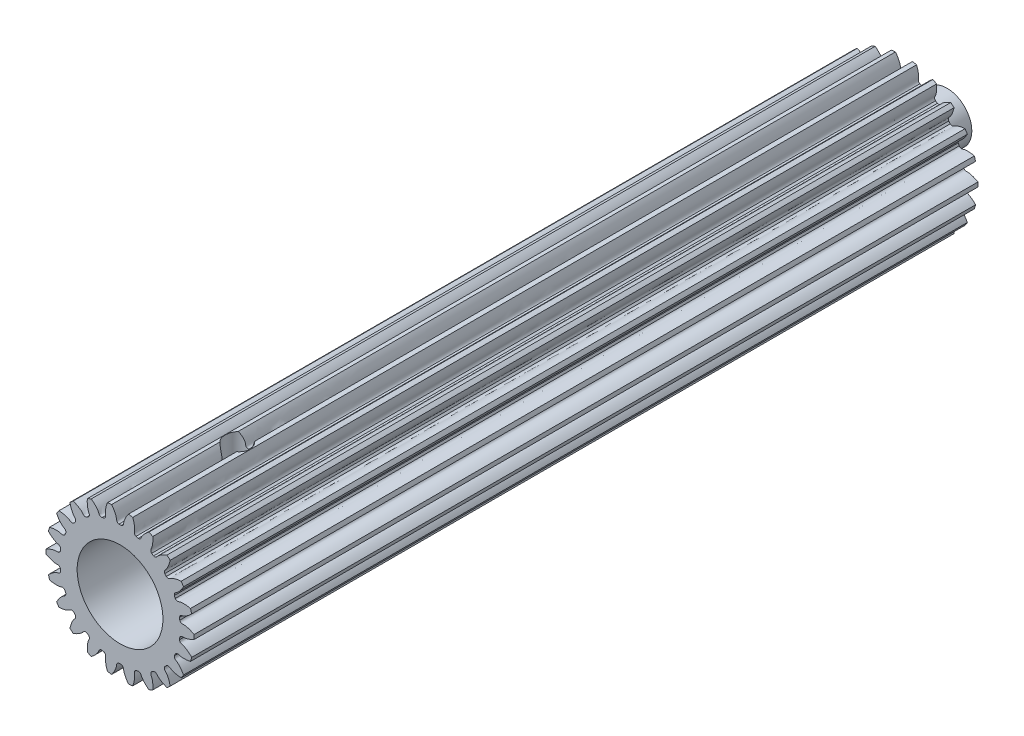
from build123d import *
from build123d.topology import SkipClean

# Parameters (mm, degrees)
SKETCH_1_R               = 12
EXTRUDE_1_DEPTH          = 30
CUT_EXTRUDE_1_DEPTH      = 35.467375879
PATTERN_CIRCULAR_1_COUNT = 22
EXTRUDE_START            = 97
EXTRUDE_2_DEPTH          = 97
SKETCH_12_R              = 5
EXTRUDE_7_DEPTH          = 1
CUT_EXTRUDE_START        = 130
SKETCH_15_R              = 2
CUT_EXTRUDE_3_DEPTH      = 231.171769671
SKETCH_16_R              = 6.95
CUT_EXTRUDE_4_DEPTH      = 25
CUT_EXTRUDE_START_2      = -1
SKETCH_17_R              = 5
CUT_EXTRUDE_5_DEPTH      = 1
SKETCH_18_R              = 4
EXTRUDE_8_DEPTH          = 7


with BuildPart() as part:
    # 草图1 → 凸台-拉伸1 (new body)
    with BuildSketch(Plane.XY):
        Circle(SKETCH_1_R)
    extrude(amount=EXTRUDE_1_DEPTH)

    # 草图2 → 切除-拉伸1 (cut, through all)
    with BuildSketch(Plane.XY):
        with BuildLine():
            ThreePointArc((0.185665431, 9.748232063), (0, 9.75), (-0.185665431, 9.748232063))
            add(Edge.make_bspline(
                [(-0.185665431, 9.748232063), (-0.588158706, 9.876186429), (-0.548347264, 10.151774696), (-0.599584047, 10.42157039), (-0.60596118, 10.451918903), (-0.613876897, 10.486162213), (-0.623483721, 10.524250431), (-0.634939934, 10.566127653), (-0.648399943, 10.611733662), (-0.664017171, 10.661003439), (-0.681942991, 10.713867378), (-0.70232689, 10.77025128), (-0.72531626, 10.830076418), (-0.751056303, 10.893259589), (-0.779689902, 10.959713172), (-0.811357505, 11.029345185), (-0.846197011, 11.10205935), (-0.884343649, 11.177755162), (-0.925929868, 11.25632795), (-0.971085225, 11.337668957), (-1.019936271, 11.421665408), (-1.072606448, 11.508200591), (-1.129215979, 11.597153935), (-1.189881763, 11.688401095), (-1.254717274, 11.781814033), (-1.323832459, 11.877261111), (-1.397333644, 11.974607178), (-1.475323431, 12.073713662), (-1.557900608, 12.174438668), (-1.64516006, 12.276637076), (-1.737192673, 12.380160638), (-1.834085256, 12.484858081), (-1.935920447, 12.590575215), (-2.042776642, 12.697155033), (-2.154727905, 12.804437827), (-2.271843904, 12.912261294), (-2.394189822, 13.020460649), (-2.521826308, 13.128868741), (-2.654809363, 13.237316171), (-2.841488127, 13.383435539), (-2.986445715, 13.489968103), (-3.085558798, 13.559868128)],
                knots=[0, 0, 0, 0, 0.157021319, 0.162530984, 0.168888289, 0.176093235, 0.184145822, 0.19304605, 0.202793918, 0.213389427, 0.224832576, 0.237123367, 0.250261798, 0.264247869, 0.279081582, 0.294762935, 0.311291928, 0.328668563, 0.346892838, 0.365964754, 0.38588431, 0.406651508, 0.428266346, 0.450728824, 0.474038944, 0.498196704, 0.523202104, 0.549055146, 0.575755828, 0.603304151, 0.631700114, 0.660943719, 0.691034964, 0.721973849, 0.753760376, 0.786394543, 0.819876351, 0.854205799, 0.889382888, 0.925407618, 1, 1, 1, 1], degree=3))
            ThreePointArc((-3.085558798, 13.559868128), (0, 13.906498364), (3.085558798, 13.559868128))
            add(Edge.make_bspline(
                [(0.185665431, 9.748232063), (0.588158706, 9.876186429), (0.548347264, 10.151774696), (0.599584047, 10.42157039), (0.60596118, 10.451918903), (0.613876897, 10.486162213), (0.623483721, 10.524250431), (0.634939934, 10.566127653), (0.648399943, 10.611733662), (0.664017171, 10.661003439), (0.681942991, 10.713867378), (0.70232689, 10.77025128), (0.72531626, 10.830076418), (0.751056303, 10.893259589), (0.779689902, 10.959713172), (0.811357505, 11.029345185), (0.846197011, 11.10205935), (0.884343649, 11.177755162), (0.925929868, 11.25632795), (0.971085225, 11.337668957), (1.019936271, 11.421665408), (1.072606448, 11.508200591), (1.129215979, 11.597153935), (1.189881763, 11.688401095), (1.254717274, 11.781814033), (1.323832459, 11.877261111), (1.397333644, 11.974607178), (1.475323431, 12.073713662), (1.557900608, 12.174438668), (1.64516006, 12.276637076), (1.737192673, 12.380160638), (1.834085256, 12.484858081), (1.935920447, 12.590575215), (2.042776642, 12.697155033), (2.154727905, 12.804437827), (2.271843904, 12.912261294), (2.394189822, 13.020460649), (2.521826308, 13.128868741), (2.654809363, 13.237316171), (2.841488127, 13.383435539), (2.986445715, 13.489968103), (3.085558798, 13.559868128)],
                knots=[0, 0, 0, 0, 0.157021319, 0.162530984, 0.168888289, 0.176093235, 0.184145822, 0.19304605, 0.202793918, 0.213389427, 0.224832576, 0.237123367, 0.250261798, 0.264247869, 0.279081582, 0.294762935, 0.311291928, 0.328668563, 0.346892838, 0.365964754, 0.38588431, 0.406651508, 0.428266346, 0.450728824, 0.474038944, 0.498196704, 0.523202104, 0.549055146, 0.575755828, 0.603304151, 0.631700114, 0.660943719, 0.691034964, 0.721973849, 0.753760376, 0.786394543, 0.819876351, 0.854205799, 0.889382888, 0.925407618, 1, 1, 1, 1], degree=3))
        make_face()
    cut_extrude_1 = extrude(amount=CUT_EXTRUDE_1_DEPTH, mode=Mode.SUBTRACT)

    # 阵列(圆周)1: 切除-拉伸1 ×22 about axis
    pattern_circular_1_axis = Axis((0, 0, -1.5), (0, 0, 1))
    for i in range(1, PATTERN_CIRCULAR_1_COUNT):
        add(cut_extrude_1.rotate(pattern_circular_1_axis, i * 360 / PATTERN_CIRCULAR_1_COUNT), mode=Mode.SUBTRACT)

    # 草图4 → 凸台-拉伸2 (add)
    with BuildSketch(Plane(origin=(0, 0, 0), x_dir=(-1, 0, 0), z_dir=(0, 0, -1)).offset(EXTRUDE_START)):
        with BuildLine():
            ThreePointArc((2.924539021, 9.301052173), (2.746892429, 9.355056493), (2.568249667, 9.405668166))
            add(Edge.make_bspline(
                [(2.568249667, 9.405668166), (2.218109108, 9.641834941), (2.333950094, 9.895043767), (2.361944393, 10.180005258), (2.365849304, 10.238460497), (2.368085913, 10.32113962), (2.366834845, 10.420382901), (2.360772595, 10.536017252), (2.34858845, 10.667790208), (2.32898426, 10.815370787), (2.300679804, 10.978350119), (2.26241667, 11.156242389), (2.212962422, 11.348485973), (2.151114634, 11.554444777), (2.096274933, 11.713680077), (2.062581682, 11.80433527), (2.055688884, 11.822611522)],
                knots=[0, 0, 0, 0, 0.157021319, 0.162530984, 0.176093235, 0.19304605, 0.213389427, 0.237123367, 0.264247869, 0.294762935, 0.328668563, 0.365964754, 0.406651508, 0.450728824, 0.498196704, 0.510209942, 0.510209942, 0.510209942, 0.510209942], degree=3))
            ThreePointArc((2.055688884, 11.822611522), (1.707778059, 11.877857303), (1.358395532, 11.922867171))
            add(Edge.make_bspline(
                [(1.358395532, 11.922867171), (1.300155371, 11.845656586), (1.201946581, 11.708817962), (1.073915974, 11.512256119), (0.972303664, 11.341732625), (0.885472389, 11.181826213), (0.812397844, 11.033422979), (0.752009469, 10.897343589), (0.703194045, 10.774341044), (0.670055832, 10.680054419), (0.644027119, 10.597938124), (0.627360159, 10.539619361), (0.611348785, 10.476138997), (0.60176986, 10.433080149), (0.548347264, 10.151774696), (0.588158706, 9.876186429), (0.185665431, 9.748232063)],
                knots=[0.489790058, 0.489790058, 0.489790058, 0.489790058, 0.549271176, 0.593348492, 0.634035246, 0.671331437, 0.705237065, 0.735752131, 0.762876633, 0.786610573, 0.797206082, 0.815854178, 0.823906765, 0.837469016, 0.842978681, 1, 1, 1, 1], degree=3))
            ThreePointArc((0.185665431, 9.748232063), (0, 9.75), (-0.185665431, 9.748232063))
            add(Edge.make_bspline(
                [(-0.185665431, 9.748232063), (-0.588158706, 9.876186429), (-0.548347264, 10.151774696), (-0.60176986, 10.433080149), (-0.61449187, 10.490267681), (-0.635639261, 10.570227844), (-0.664799714, 10.665098608), (-0.703194362, 10.774341023), (-0.752009695, 10.897343577), (-0.812398032, 11.033422968), (-0.885472542, 11.181826205), (-0.972303795, 11.341732617), (-1.073916075, 11.512256114), (-1.191283893, 11.692447604), (-1.288763969, 11.829782626), (-1.346632927, 11.907273161), (-1.358395532, 11.922867171)],
                knots=[0, 0, 0, 0, 0.157021319, 0.162530984, 0.176093235, 0.19304605, 0.213389427, 0.237123367, 0.264247869, 0.294762935, 0.328668563, 0.365964754, 0.406651508, 0.450728824, 0.498196704, 0.510209942, 0.510209942, 0.510209942, 0.510209942], degree=3))
            ThreePointArc((-1.358395532, 11.922867171), (-1.707778059, 11.877857303), (-2.055688884, 11.822611522))
            add(Edge.make_bspline(
                [(-2.055688884, 11.822611522), (-2.089817174, 11.732120359), (-2.145495923, 11.573156047), (-2.21296252, 11.34848595), (-2.262416797, 11.156242359), (-2.300679954, 10.978350084), (-2.328984444, 10.815370745), (-2.348588671, 10.667790156), (-2.360772906, 10.536017183), (-2.366005176, 10.436213716), (-2.36784471, 10.350090571), (-2.367406247, 10.289438503), (-2.364884562, 10.224018615), (-2.361944393, 10.180005258), (-2.333950094, 9.895043767), (-2.218109108, 9.641834941), (-2.568249667, 9.405668166)],
                knots=[0.489790058, 0.489790058, 0.489790058, 0.489790058, 0.549271176, 0.593348492, 0.634035246, 0.671331437, 0.705237065, 0.735752131, 0.762876633, 0.786610573, 0.797206082, 0.815854178, 0.823906765, 0.837469016, 0.842978681, 1, 1, 1, 1], degree=3))
            ThreePointArc((-2.568249667, 9.405668166), (-2.746892429, 9.355056493), (-2.924539021, 9.301052173))
            add(Edge.make_bspline(
                [(-2.924539021, 9.301052173), (-3.3467774, 9.310428028), (-3.386220788, 9.586069213), (-3.516732299, 9.840928935), (-3.545050567, 9.892215766), (-3.587868721, 9.962979072), (-3.642576155, 10.045791454), (-3.710192695, 10.139791761), (-3.791684488, 10.244058979), (-3.887964667, 10.357612838), (-3.999889169, 10.479417233), (-4.128253989, 10.608383121), (-4.273792278, 10.74337173), (-4.437171685, 10.883197863), (-4.569394878, 10.987506541), (-4.646751344, 11.045554595), (-4.662430821, 11.057203029)],
                knots=[0, 0, 0, 0, 0.157021319, 0.162530984, 0.176093235, 0.19304605, 0.213389427, 0.237123367, 0.264247869, 0.294762935, 0.328668563, 0.365964754, 0.406651508, 0.450728824, 0.498196704, 0.510209942, 0.510209942, 0.510209942, 0.510209942], degree=3))
            ThreePointArc((-4.662430821, 11.057203029), (-4.984980156, 10.915583944), (-5.303233613, 10.7645582))
            add(Edge.make_bspline(
                [(-5.303233613, 10.7645582), (-5.310485161, 10.668117515), (-5.319123107, 10.499905858), (-5.320559952, 10.265328941), (-5.313849705, 10.066939687), (-5.300444889, 9.885473322), (-5.281686262, 9.721121495), (-5.258918124, 9.573995807), (-5.233484075, 9.44412787), (-5.210386516, 9.346893044), (-5.187887842, 9.263740235), (-5.170379477, 9.205668531), (-5.149529026, 9.143609049), (-5.134307959, 9.102206883), (-5.027164697, 8.83667524), (-4.844678915, 8.626359328), (-5.114100451, 8.301112972)],
                knots=[0.489790058, 0.489790058, 0.489790058, 0.489790058, 0.549271176, 0.593348492, 0.634035246, 0.671331437, 0.705237065, 0.735752131, 0.762876633, 0.786610573, 0.797206082, 0.815854178, 0.823906765, 0.837469016, 0.842978681, 1, 1, 1, 1], degree=3))
            ThreePointArc((-5.114100451, 8.301112972), (-5.27124797, 8.202221945), (-5.426483851, 8.100356351))
            add(Edge.make_bspline(
                [(-5.426483851, 8.100356351), (-5.834260094, 7.99039412), (-5.949762843, 8.243757414), (-6.146790001, 8.451524185), (-6.188410351, 8.49275536), (-6.249430396, 8.548588987), (-6.325252738, 8.612634021), (-6.41661328, 8.683776874), (-6.524179553, 8.760861647), (-6.648551527, 8.842690515), (-6.790258564, 8.928028199), (-6.949757596, 9.015605514), (-7.127431248, 9.104123262), (-7.323586215, 9.192256156), (-7.479840591, 9.255088021), (-7.570417602, 9.288990887), (-7.588743694, 9.295750058)],
                knots=[0, 0, 0, 0, 0.157021319, 0.162530984, 0.176093235, 0.19304605, 0.213389427, 0.237123367, 0.264247869, 0.294762935, 0.328668563, 0.365964754, 0.406651508, 0.450728824, 0.498196704, 0.510209942, 0.510209942, 0.510209942, 0.510209942], degree=3))
            ThreePointArc((-7.588743694, 9.295750058), (-7.858328807, 9.068994892), (-8.121141894, 8.834424392))
            add(Edge.make_bspline(
                [(-8.121141894, 8.834424392), (-8.100929222, 8.739847235), (-8.061826571, 8.576015742), (-7.997117259, 8.350536032), (-7.934786112, 8.162073431), (-7.870799303, 7.991734302), (-7.806497272, 7.839324794), (-7.743201307, 7.704573257), (-7.68220949, 7.587131484), (-7.632653327, 7.500342686), (-7.587639155, 7.426896759), (-7.554479312, 7.376110043), (-7.516989274, 7.322438657), (-7.49072043, 7.287001839), (-7.313108313, 7.06241184), (-7.078761648, 6.912027385), (-7.245637231, 6.524050974)],
                knots=[0.489790058, 0.489790058, 0.489790058, 0.489790058, 0.549271176, 0.593348492, 0.634035246, 0.671331437, 0.705237065, 0.735752131, 0.762876633, 0.786610573, 0.797206082, 0.815854178, 0.823906765, 0.837469016, 0.842978681, 1, 1, 1, 1], degree=3))
            ThreePointArc((-7.245637231, 6.524050974), (-7.36855835, 6.384892156), (-7.488807233, 6.243417832))
            add(Edge.make_bspline(
                [(-7.488807233, 6.243417832), (-7.849085732, 6.023026001), (-8.031290497, 6.233585417), (-8.278871334, 6.377427208), (-8.330421932, 6.405262424), (-8.404700387, 6.441643063), (-8.495494963, 6.481732201), (-8.603198018, 6.52425403), (-8.728124391, 6.567911406), (-8.870512283, 6.611385996), (-9.030521594, 6.653343419), (-9.208233175, 6.692437167), (-9.403648127, 6.727312872), (-9.616687345, 6.756612524), (-9.784314102, 6.772877312), (-9.88077365, 6.77988838), (-9.900261685, 6.781210701)],
                knots=[0, 0, 0, 0, 0.157021319, 0.162530984, 0.176093235, 0.19304605, 0.213389427, 0.237123367, 0.264247869, 0.294762935, 0.328668563, 0.365964754, 0.406651508, 0.450728824, 0.498196704, 0.510209942, 0.510209942, 0.510209942, 0.510209942], degree=3))
            ThreePointArc((-9.900261685, 6.781210701), (-10.095042394, 6.487689809), (-10.281123557, 6.188578059))
            add(Edge.make_bspline(
                [(-10.281123557, 6.188578059), (-10.235084176, 6.103526509), (-10.151408791, 5.957347833), (-10.025795686, 5.759232356), (-9.912893339, 5.595964528), (-9.803508366, 5.450552498), (-9.698872299, 5.322432622), (-9.60017637, 5.210972003), (-9.508567979, 5.115470827), (-9.43656796, 5.046159169), (-9.372685068, 4.988370276), (-9.326560161, 4.948982987), (-9.275467756, 4.908047833), (-9.240279279, 4.881447244), (-9.006587387, 4.715993833), (-8.739365211, 4.637724091), (-8.790175575, 4.218449166)],
                knots=[0.489790058, 0.489790058, 0.489790058, 0.489790058, 0.549271176, 0.593348492, 0.634035246, 0.671331437, 0.705237065, 0.735752131, 0.762876633, 0.786610573, 0.797206082, 0.815854178, 0.823906765, 0.837469016, 0.842978681, 1, 1, 1, 1], degree=3))
            ThreePointArc((-8.790175575, 4.218449166), (-8.868911955, 4.050296377), (-8.94443199, 3.880674732))
            add(Edge.make_bspline(
                [(-8.94443199, 3.880674732), (-9.228025124, 3.567708136), (-9.462170759, 3.718405401), (-9.740247748, 3.786669007), (-9.797552271, 3.798853219), (-9.879071537, 3.812833528), (-9.97748271, 3.825718986), (-10.092802818, 3.836174925), (-10.2249685, 3.842868044), (-10.373836889, 3.844466303), (-10.53918547, 3.839644323), (-10.720712465, 3.827087362), (-10.91803736, 3.805495601), (-11.130701659, 3.773588328), (-11.296120675, 3.741968363), (-11.390648179, 3.721519639), (-11.409719353, 3.717297982)],
                knots=[0, 0, 0, 0, 0.157021319, 0.162530984, 0.176093235, 0.19304605, 0.213389427, 0.237123367, 0.264247869, 0.294762935, 0.328668563, 0.365964754, 0.406651508, 0.450728824, 0.498196704, 0.510209942, 0.510209942, 0.510209942, 0.510209942], degree=3))
            ThreePointArc((-11.409719353, 3.717297982), (-11.513915683, 3.380790682), (-11.608189734, 3.041369937))
            add(Edge.make_bspline(
                [(-11.608189734, 3.041369937), (-11.540053481, 2.972734366), (-11.418584245, 2.856051033), (-11.242243773, 2.701349926), (-11.087916901, 2.576503859), (-10.941995486, 2.467799346), (-10.805502374, 2.374348612), (-10.679402238, 2.295208787), (-10.564598841, 2.229385146), (-10.475987977, 2.183165848), (-10.398411779, 2.145715701), (-10.343058573, 2.120918762), (-10.282503004, 2.096036163), (-10.241245656, 2.080426825), (-9.970406315, 1.987514054), (-9.69195738, 1.987699973), (-9.62258617, 1.571093695)],
                knots=[0.489790058, 0.489790058, 0.489790058, 0.489790058, 0.549271176, 0.593348492, 0.634035246, 0.671331437, 0.705237065, 0.735752131, 0.762876633, 0.786610573, 0.797206082, 0.815854178, 0.823906765, 0.837469016, 0.842978681, 1, 1, 1, 1], degree=3))
            ThreePointArc((-9.62258617, 1.571093695), (-9.650759058, 1.387569673), (-9.675432062, 1.203542444))
            add(Edge.make_bspline(
                [(-9.675432062, 1.203542444), (-9.859364802, 0.823355776), (-10.126482219, 0.901982294), (-10.412527217, 0.889137403), (-10.470943193, 0.88468352), (-10.553099064, 0.875130897), (-10.651154146, 0.859768772), (-10.764748758, 0.837311742), (-10.893446471, 0.806498368), (-11.036734926, 0.766090814), (-11.194027219, 0.71488008), (-11.36466339, 0.651689699), (-11.547912138, 0.575379709), (-11.742972721, 0.484850449), (-11.892782731, 0.407907392), (-11.977720136, 0.361655509), (-11.994829415, 0.352231889)],
                knots=[0, 0, 0, 0, 0.157021319, 0.162530984, 0.176093235, 0.19304605, 0.213389427, 0.237123367, 0.264247869, 0.294762935, 0.328668563, 0.365964754, 0.406651508, 0.450728824, 0.498196704, 0.510209942, 0.510209942, 0.510209942, 0.510209942], degree=3))
            ThreePointArc((-11.994829415, 0.352231889), (-12, 0), (-11.994829415, -0.352231889))
            add(Edge.make_bspline(
                [(-11.994829415, -0.352231889), (-11.910116284, -0.398891037), (-11.760693911, -0.476626036), (-11.547912129, -0.57537981), (-11.364663379, -0.651689829), (-11.194027205, -0.714880233), (-11.03673491, -0.766091002), (-10.89344645, -0.806498594), (-10.764748734, -0.83731206), (-10.666705752, -0.856694587), (-10.58172101, -0.870771999), (-10.521623893, -0.878969688), (-10.456511011, -0.885783891), (-10.412527217, -0.889137403), (-10.126482219, -0.901982294), (-9.859364802, -0.823355776), (-9.675432062, -1.203542444)],
                knots=[0.489790058, 0.489790058, 0.489790058, 0.489790058, 0.549271176, 0.593348492, 0.634035246, 0.671331437, 0.705237065, 0.735752131, 0.762876633, 0.786610573, 0.797206082, 0.815854178, 0.823906765, 0.837469016, 0.842978681, 1, 1, 1, 1], degree=3))
            ThreePointArc((-9.675432062, -1.203542444), (-9.650759058, -1.387569673), (-9.62258617, -1.571093695))
            add(Edge.make_bspline(
                [(-9.62258617, -1.571093695), (-9.69195738, -1.987699973), (-9.970406315, -1.987514054), (-10.241245656, -2.080426825), (-10.296040571, -2.101157977), (-10.372177267, -2.133469636), (-10.461932418, -2.175834796), (-10.564598775, -2.229385458), (-10.679402194, -2.29520901), (-10.805502337, -2.374348797), (-10.941995455, -2.467799496), (-11.087916875, -2.576503987), (-11.242243753, -2.701350024), (-11.403897972, -2.843167131), (-11.52596226, -2.959199811), (-11.594428442, -3.027507799), (-11.608189734, -3.041369937)],
                knots=[0, 0, 0, 0, 0.157021319, 0.162530984, 0.176093235, 0.19304605, 0.213389427, 0.237123367, 0.264247869, 0.294762935, 0.328668563, 0.365964754, 0.406651508, 0.450728824, 0.498196704, 0.510209942, 0.510209942, 0.510209942, 0.510209942], degree=3))
            ThreePointArc((-11.608189734, -3.041369937), (-11.513915683, -3.380790682), (-11.409719353, -3.717297982))
            add(Edge.make_bspline(
                [(-11.409719353, -3.717297982), (-11.315292297, -3.73820066), (-11.150022101, -3.770689699), (-10.918037323, -3.805495695), (-10.720712418, -3.827087483), (-10.539185414, -3.839644466), (-10.373836821, -3.844466479), (-10.224968417, -3.842868255), (-10.092802706, -3.836175223), (-9.993270464, -3.827150722), (-9.907762136, -3.816714931), (-9.847789818, -3.807649241), (-9.783394683, -3.795843002), (-9.740247748, -3.786669007), (-9.462170759, -3.718405401), (-9.228025124, -3.567708136), (-8.94443199, -3.880674732)],
                knots=[0.489790058, 0.489790058, 0.489790058, 0.489790058, 0.549271176, 0.593348492, 0.634035246, 0.671331437, 0.705237065, 0.735752131, 0.762876633, 0.786610573, 0.797206082, 0.815854178, 0.823906765, 0.837469016, 0.842978681, 1, 1, 1, 1], degree=3))
            ThreePointArc((-8.94443199, -3.880674732), (-8.868911955, -4.050296377), (-8.790175575, -4.218449166))
            add(Edge.make_bspline(
                [(-8.790175575, -4.218449166), (-8.739365211, -4.637724091), (-9.006587387, -4.715993833), (-9.240279279, -4.881447244), (-9.287013975, -4.916776151), (-9.350963354, -4.969229146), (-9.425147146, -5.035165168), (-9.508567828, -5.115471107), (-9.600176265, -5.210972204), (-9.698872211, -5.322432789), (-9.803508295, -5.450552634), (-9.912893278, -5.595964644), (-10.02579564, -5.759232445), (-10.14094723, -5.940848218), (-10.225376874, -6.086570243), (-10.27182511, -6.171400431), (-10.281123557, -6.188578059)],
                knots=[0, 0, 0, 0, 0.157021319, 0.162530984, 0.176093235, 0.19304605, 0.213389427, 0.237123367, 0.264247869, 0.294762935, 0.328668563, 0.365964754, 0.406651508, 0.450728824, 0.498196704, 0.510209942, 0.510209942, 0.510209942, 0.510209942], degree=3))
            ThreePointArc((-10.281123557, -6.188578059), (-10.095042394, -6.487689809), (-9.900261685, -6.781210701))
            add(Edge.make_bspline(
                [(-9.900261685, -6.781210701), (-9.803770624, -6.774663498), (-9.636041811, -6.759274507), (-9.403648065, -6.727312951), (-9.208233095, -6.69243727), (-9.0305215, -6.65334354), (-8.870512168, -6.611386145), (-8.728124252, -6.567911585), (-8.603197826, -6.524254284), (-8.510239836, -6.487553866), (-8.431135298, -6.453450317), (-8.37614638, -6.427855698), (-8.317685902, -6.398385488), (-8.278871334, -6.377427208), (-8.031290497, -6.233585417), (-7.849085732, -6.023026001), (-7.488807233, -6.243417832)],
                knots=[0.489790058, 0.489790058, 0.489790058, 0.489790058, 0.549271176, 0.593348492, 0.634035246, 0.671331437, 0.705237065, 0.735752131, 0.762876633, 0.786610573, 0.797206082, 0.815854178, 0.823906765, 0.837469016, 0.842978681, 1, 1, 1, 1], degree=3))
            ThreePointArc((-7.488807233, -6.243417832), (-7.36855835, -6.384892156), (-7.245637231, -6.524050974))
            add(Edge.make_bspline(
                [(-7.245637231, -6.524050974), (-7.078761648, -6.912027385), (-7.313108313, -7.06241184), (-7.49072043, -7.287001839), (-7.525608738, -7.334066362), (-7.572190001, -7.402411265), (-7.624792505, -7.486576403), (-7.682209266, -7.58713171), (-7.743201149, -7.70457342), (-7.80649714, -7.83932493), (-7.870799196, -7.991734412), (-7.934786021, -8.162073525), (-7.997117189, -8.350536104), (-8.056437255, -8.557237115), (-8.096392266, -8.720842953), (-8.117059596, -8.815322902), (-8.121141894, -8.834424392)],
                knots=[0, 0, 0, 0, 0.157021319, 0.162530984, 0.176093235, 0.19304605, 0.213389427, 0.237123367, 0.264247869, 0.294762935, 0.328668563, 0.365964754, 0.406651508, 0.450728824, 0.498196704, 0.510209942, 0.510209942, 0.510209942, 0.510209942], degree=3))
            ThreePointArc((-8.121141894, -8.834424392), (-7.858328807, -9.068994892), (-7.588743694, -9.295750058))
            add(Edge.make_bspline(
                [(-7.588743694, -9.295750058), (-7.498005759, -9.262283389), (-7.341406722, -9.200263094), (-7.127431166, -9.104123321), (-6.94975749, -9.015605591), (-6.79025844, -8.928028289), (-6.648551375, -8.842690626), (-6.524179369, -8.760861779), (-6.416613024, -8.683777064), (-6.337760188, -8.622373978), (-6.271468019, -8.56736554), (-6.225917377, -8.527315513), (-6.178127677, -8.482568835), (-6.146790001, -8.451524185), (-5.949762843, -8.243757414), (-5.834260094, -7.99039412), (-5.426483851, -8.100356351)],
                knots=[0.489790058, 0.489790058, 0.489790058, 0.489790058, 0.549271176, 0.593348492, 0.634035246, 0.671331437, 0.705237065, 0.735752131, 0.762876633, 0.786610573, 0.797206082, 0.815854178, 0.823906765, 0.837469016, 0.842978681, 1, 1, 1, 1], degree=3))
            ThreePointArc((-5.426483851, -8.100356351), (-5.27124797, -8.202221945), (-5.114100451, -8.301112972))
            add(Edge.make_bspline(
                [(-5.114100451, -8.301112972), (-4.844678915, -8.626359328), (-5.027164697, -8.83667524), (-5.134307959, -9.102206883), (-5.154523438, -9.157194134), (-5.179962849, -9.235894046), (-5.206722521, -9.331469743), (-5.233483796, -9.444128024), (-5.258917927, -9.573995919), (-5.281686098, -9.721121587), (-5.300444756, -9.885473397), (-5.313849591, -10.066939751), (-5.320559864, -10.265328991), (-5.319242647, -10.480369552), (-5.311486107, -10.648604832), (-5.304698188, -10.745080339), (-5.303233613, -10.7645582)],
                knots=[0, 0, 0, 0, 0.157021319, 0.162530984, 0.176093235, 0.19304605, 0.213389427, 0.237123367, 0.264247869, 0.294762935, 0.328668563, 0.365964754, 0.406651508, 0.450728824, 0.498196704, 0.510209942, 0.510209942, 0.510209942, 0.510209942], degree=3))
            ThreePointArc((-5.303233613, -10.7645582), (-4.984980156, -10.915583944), (-4.662430821, -11.057203029))
            add(Edge.make_bspline(
                [(-4.662430821, -11.057203029), (-4.584797061, -10.999528165), (-4.452014522, -10.89590108), (-4.273792183, -10.743371764), (-4.128253866, -10.608383165), (-3.999889025, -10.479417284), (-3.887964489, -10.357612901), (-3.791684274, -10.244059055), (-3.710192396, -10.139791871), (-3.651832902, -10.05866063), (-3.6037237, -9.987203758), (-3.571301575, -9.93594294), (-3.538054289, -9.879544902), (-3.516732299, -9.840928935), (-3.386220788, -9.586069213), (-3.3467774, -9.310428028), (-2.924539021, -9.301052173)],
                knots=[0.489790058, 0.489790058, 0.489790058, 0.489790058, 0.549271176, 0.593348492, 0.634035246, 0.671331437, 0.705237065, 0.735752131, 0.762876633, 0.786610573, 0.797206082, 0.815854178, 0.823906765, 0.837469016, 0.842978681, 1, 1, 1, 1], degree=3))
            ThreePointArc((-2.924539021, -9.301052173), (-2.746892429, -9.355056493), (-2.568249667, -9.405668166))
            add(Edge.make_bspline(
                [(-2.568249667, -9.405668166), (-2.218109108, -9.641834941), (-2.333950094, -9.895043767), (-2.361944393, -10.180005258), (-2.365849304, -10.238460497), (-2.368085913, -10.32113962), (-2.366834845, -10.420382901), (-2.360772595, -10.536017252), (-2.34858845, -10.667790208), (-2.32898426, -10.815370787), (-2.300679804, -10.978350119), (-2.26241667, -11.156242389), (-2.212962422, -11.348485973), (-2.151114634, -11.554444777), (-2.096274933, -11.713680077), (-2.062581682, -11.80433527), (-2.055688884, -11.822611522)],
                knots=[0, 0, 0, 0, 0.157021319, 0.162530984, 0.176093235, 0.19304605, 0.213389427, 0.237123367, 0.264247869, 0.294762935, 0.328668563, 0.365964754, 0.406651508, 0.450728824, 0.498196704, 0.510209942, 0.510209942, 0.510209942, 0.510209942], degree=3))
            ThreePointArc((-2.055688884, -11.822611522), (-1.707778059, -11.877857303), (-1.358395532, -11.922867171))
            add(Edge.make_bspline(
                [(-1.358395532, -11.922867171), (-1.300155371, -11.845656586), (-1.201946581, -11.708817962), (-1.073915974, -11.512256119), (-0.972303664, -11.341732625), (-0.885472389, -11.181826213), (-0.812397844, -11.033422979), (-0.752009469, -10.897343589), (-0.703194045, -10.774341044), (-0.670055832, -10.680054419), (-0.644027119, -10.597938124), (-0.627360159, -10.539619361), (-0.611348785, -10.476138997), (-0.60176986, -10.433080149), (-0.548347264, -10.151774696), (-0.588158706, -9.876186429), (-0.185665431, -9.748232063)],
                knots=[0.489790058, 0.489790058, 0.489790058, 0.489790058, 0.549271176, 0.593348492, 0.634035246, 0.671331437, 0.705237065, 0.735752131, 0.762876633, 0.786610573, 0.797206082, 0.815854178, 0.823906765, 0.837469016, 0.842978681, 1, 1, 1, 1], degree=3))
            ThreePointArc((-0.185665431, -9.748232063), (0, -9.75), (0.185665431, -9.748232063))
            add(Edge.make_bspline(
                [(0.185665431, -9.748232063), (0.588158706, -9.876186429), (0.548347264, -10.151774696), (0.60176986, -10.433080149), (0.61449187, -10.490267681), (0.635639261, -10.570227844), (0.664799714, -10.665098608), (0.703194362, -10.774341023), (0.752009695, -10.897343577), (0.812398032, -11.033422968), (0.885472542, -11.181826205), (0.972303795, -11.341732617), (1.073916075, -11.512256114), (1.191283893, -11.692447604), (1.288763969, -11.829782626), (1.346632927, -11.907273161), (1.358395532, -11.922867171)],
                knots=[0, 0, 0, 0, 0.157021319, 0.162530984, 0.176093235, 0.19304605, 0.213389427, 0.237123367, 0.264247869, 0.294762935, 0.328668563, 0.365964754, 0.406651508, 0.450728824, 0.498196704, 0.510209942, 0.510209942, 0.510209942, 0.510209942], degree=3))
            ThreePointArc((1.358395532, -11.922867171), (1.707778059, -11.877857303), (2.055688884, -11.822611522))
            add(Edge.make_bspline(
                [(2.055688884, -11.822611522), (2.089817174, -11.732120359), (2.145495923, -11.573156047), (2.21296252, -11.34848595), (2.262416797, -11.156242359), (2.300679954, -10.978350084), (2.328984444, -10.815370745), (2.348588671, -10.667790156), (2.360772906, -10.536017183), (2.366005176, -10.436213716), (2.36784471, -10.350090571), (2.367406247, -10.289438503), (2.364884562, -10.224018615), (2.361944393, -10.180005258), (2.333950094, -9.895043767), (2.218109108, -9.641834941), (2.568249667, -9.405668166)],
                knots=[0.489790058, 0.489790058, 0.489790058, 0.489790058, 0.549271176, 0.593348492, 0.634035246, 0.671331437, 0.705237065, 0.735752131, 0.762876633, 0.786610573, 0.797206082, 0.815854178, 0.823906765, 0.837469016, 0.842978681, 1, 1, 1, 1], degree=3))
            ThreePointArc((2.568249667, -9.405668166), (2.746892429, -9.355056493), (2.924539021, -9.301052173))
            add(Edge.make_bspline(
                [(2.924539021, -9.301052173), (3.3467774, -9.310428028), (3.386220788, -9.586069213), (3.516732299, -9.840928935), (3.545050567, -9.892215766), (3.587868721, -9.962979072), (3.642576155, -10.045791454), (3.710192695, -10.139791761), (3.791684488, -10.244058979), (3.887964667, -10.357612838), (3.999889169, -10.479417233), (4.128253989, -10.608383121), (4.273792278, -10.74337173), (4.437171685, -10.883197863), (4.569394878, -10.987506541), (4.646751344, -11.045554595), (4.662430821, -11.057203029)],
                knots=[0, 0, 0, 0, 0.157021319, 0.162530984, 0.176093235, 0.19304605, 0.213389427, 0.237123367, 0.264247869, 0.294762935, 0.328668563, 0.365964754, 0.406651508, 0.450728824, 0.498196704, 0.510209942, 0.510209942, 0.510209942, 0.510209942], degree=3))
            ThreePointArc((4.662430821, -11.057203029), (4.984980156, -10.915583944), (5.303233613, -10.7645582))
            add(Edge.make_bspline(
                [(5.303233613, -10.7645582), (5.310485161, -10.668117515), (5.319123107, -10.499905858), (5.320559952, -10.265328941), (5.313849705, -10.066939687), (5.300444889, -9.885473322), (5.281686262, -9.721121495), (5.258918124, -9.573995807), (5.233484075, -9.44412787), (5.210386516, -9.346893044), (5.187887842, -9.263740235), (5.170379477, -9.205668531), (5.149529026, -9.143609049), (5.134307959, -9.102206883), (5.027164697, -8.83667524), (4.844678915, -8.626359328), (5.114100451, -8.301112972)],
                knots=[0.489790058, 0.489790058, 0.489790058, 0.489790058, 0.549271176, 0.593348492, 0.634035246, 0.671331437, 0.705237065, 0.735752131, 0.762876633, 0.786610573, 0.797206082, 0.815854178, 0.823906765, 0.837469016, 0.842978681, 1, 1, 1, 1], degree=3))
            ThreePointArc((5.114100451, -8.301112972), (5.27124797, -8.202221945), (5.426483851, -8.100356351))
            add(Edge.make_bspline(
                [(5.426483851, -8.100356351), (5.834260094, -7.99039412), (5.949762843, -8.243757414), (6.146790001, -8.451524185), (6.188410351, -8.49275536), (6.249430396, -8.548588987), (6.325252738, -8.612634021), (6.41661328, -8.683776874), (6.524179553, -8.760861647), (6.648551527, -8.842690515), (6.790258564, -8.928028199), (6.949757596, -9.015605514), (7.127431248, -9.104123262), (7.323586215, -9.192256156), (7.479840591, -9.255088021), (7.570417602, -9.288990887), (7.588743694, -9.295750058)],
                knots=[0, 0, 0, 0, 0.157021319, 0.162530984, 0.176093235, 0.19304605, 0.213389427, 0.237123367, 0.264247869, 0.294762935, 0.328668563, 0.365964754, 0.406651508, 0.450728824, 0.498196704, 0.510209942, 0.510209942, 0.510209942, 0.510209942], degree=3))
            ThreePointArc((7.588743694, -9.295750058), (7.858328807, -9.068994892), (8.121141894, -8.834424392))
            add(Edge.make_bspline(
                [(8.121141894, -8.834424392), (8.100929222, -8.739847235), (8.061826571, -8.576015742), (7.997117259, -8.350536032), (7.934786112, -8.162073431), (7.870799303, -7.991734302), (7.806497272, -7.839324794), (7.743201307, -7.704573257), (7.68220949, -7.587131484), (7.632653327, -7.500342686), (7.587639155, -7.426896759), (7.554479312, -7.376110043), (7.516989274, -7.322438657), (7.49072043, -7.287001839), (7.313108313, -7.06241184), (7.078761648, -6.912027385), (7.245637231, -6.524050974)],
                knots=[0.489790058, 0.489790058, 0.489790058, 0.489790058, 0.549271176, 0.593348492, 0.634035246, 0.671331437, 0.705237065, 0.735752131, 0.762876633, 0.786610573, 0.797206082, 0.815854178, 0.823906765, 0.837469016, 0.842978681, 1, 1, 1, 1], degree=3))
            ThreePointArc((7.245637231, -6.524050974), (7.36855835, -6.384892156), (7.488807233, -6.243417832))
            add(Edge.make_bspline(
                [(7.488807233, -6.243417832), (7.849085732, -6.023026001), (8.031290497, -6.233585417), (8.278871334, -6.377427208), (8.330421932, -6.405262424), (8.404700387, -6.441643063), (8.495494963, -6.481732201), (8.603198018, -6.52425403), (8.728124391, -6.567911406), (8.870512283, -6.611385996), (9.030521594, -6.653343419), (9.208233175, -6.692437167), (9.403648127, -6.727312872), (9.616687345, -6.756612524), (9.784314102, -6.772877312), (9.88077365, -6.77988838), (9.900261685, -6.781210701)],
                knots=[0, 0, 0, 0, 0.157021319, 0.162530984, 0.176093235, 0.19304605, 0.213389427, 0.237123367, 0.264247869, 0.294762935, 0.328668563, 0.365964754, 0.406651508, 0.450728824, 0.498196704, 0.510209942, 0.510209942, 0.510209942, 0.510209942], degree=3))
            ThreePointArc((9.900261685, -6.781210701), (10.095042394, -6.487689809), (10.281123557, -6.188578059))
            add(Edge.make_bspline(
                [(10.281123557, -6.188578059), (10.235084176, -6.103526509), (10.151408791, -5.957347833), (10.025795686, -5.759232356), (9.912893339, -5.595964528), (9.803508366, -5.450552498), (9.698872299, -5.322432622), (9.60017637, -5.210972003), (9.508567979, -5.115470827), (9.43656796, -5.046159169), (9.372685068, -4.988370276), (9.326560161, -4.948982987), (9.275467756, -4.908047833), (9.240279279, -4.881447244), (9.006587387, -4.715993833), (8.739365211, -4.637724091), (8.790175575, -4.218449166)],
                knots=[0.489790058, 0.489790058, 0.489790058, 0.489790058, 0.549271176, 0.593348492, 0.634035246, 0.671331437, 0.705237065, 0.735752131, 0.762876633, 0.786610573, 0.797206082, 0.815854178, 0.823906765, 0.837469016, 0.842978681, 1, 1, 1, 1], degree=3))
            ThreePointArc((8.790175575, -4.218449166), (8.868911955, -4.050296377), (8.94443199, -3.880674732))
            add(Edge.make_bspline(
                [(8.94443199, -3.880674732), (9.228025124, -3.567708136), (9.462170759, -3.718405401), (9.740247748, -3.786669007), (9.797552271, -3.798853219), (9.879071537, -3.812833528), (9.97748271, -3.825718986), (10.092802818, -3.836174925), (10.2249685, -3.842868044), (10.373836889, -3.844466303), (10.53918547, -3.839644323), (10.720712465, -3.827087362), (10.91803736, -3.805495601), (11.130701659, -3.773588328), (11.296120675, -3.741968363), (11.390648179, -3.721519639), (11.409719353, -3.717297982)],
                knots=[0, 0, 0, 0, 0.157021319, 0.162530984, 0.176093235, 0.19304605, 0.213389427, 0.237123367, 0.264247869, 0.294762935, 0.328668563, 0.365964754, 0.406651508, 0.450728824, 0.498196704, 0.510209942, 0.510209942, 0.510209942, 0.510209942], degree=3))
            ThreePointArc((11.409719353, -3.717297982), (11.513915683, -3.380790682), (11.608189734, -3.041369937))
            add(Edge.make_bspline(
                [(11.608189734, -3.041369937), (11.540053481, -2.972734366), (11.418584245, -2.856051033), (11.242243773, -2.701349926), (11.087916901, -2.576503859), (10.941995486, -2.467799346), (10.805502374, -2.374348612), (10.679402238, -2.295208787), (10.564598841, -2.229385146), (10.475987977, -2.183165848), (10.398411779, -2.145715701), (10.343058573, -2.120918762), (10.282503004, -2.096036163), (10.241245656, -2.080426825), (9.970406315, -1.987514054), (9.69195738, -1.987699973), (9.62258617, -1.571093695)],
                knots=[0.489790058, 0.489790058, 0.489790058, 0.489790058, 0.549271176, 0.593348492, 0.634035246, 0.671331437, 0.705237065, 0.735752131, 0.762876633, 0.786610573, 0.797206082, 0.815854178, 0.823906765, 0.837469016, 0.842978681, 1, 1, 1, 1], degree=3))
            ThreePointArc((9.62258617, -1.571093695), (9.650759058, -1.387569673), (9.675432062, -1.203542444))
            add(Edge.make_bspline(
                [(9.675432062, -1.203542444), (9.859364802, -0.823355776), (10.126482219, -0.901982294), (10.412527217, -0.889137403), (10.470943193, -0.88468352), (10.553099064, -0.875130897), (10.651154146, -0.859768772), (10.764748758, -0.837311742), (10.893446471, -0.806498368), (11.036734926, -0.766090814), (11.194027219, -0.71488008), (11.36466339, -0.651689699), (11.547912138, -0.575379709), (11.742972721, -0.484850449), (11.892782731, -0.407907392), (11.977720136, -0.361655509), (11.994829415, -0.352231889)],
                knots=[0, 0, 0, 0, 0.157021319, 0.162530984, 0.176093235, 0.19304605, 0.213389427, 0.237123367, 0.264247869, 0.294762935, 0.328668563, 0.365964754, 0.406651508, 0.450728824, 0.498196704, 0.510209942, 0.510209942, 0.510209942, 0.510209942], degree=3))
            ThreePointArc((11.994829415, -0.352231889), (12, 0), (11.994829415, 0.352231889))
            add(Edge.make_bspline(
                [(11.994829415, 0.352231889), (11.910116284, 0.398891037), (11.760693911, 0.476626036), (11.547912129, 0.57537981), (11.364663379, 0.651689829), (11.194027205, 0.714880233), (11.03673491, 0.766091002), (10.89344645, 0.806498594), (10.764748734, 0.83731206), (10.666705752, 0.856694587), (10.58172101, 0.870771999), (10.521623893, 0.878969688), (10.456511011, 0.885783891), (10.412527217, 0.889137403), (10.126482219, 0.901982294), (9.859364802, 0.823355776), (9.675432062, 1.203542444)],
                knots=[0.489790058, 0.489790058, 0.489790058, 0.489790058, 0.549271176, 0.593348492, 0.634035246, 0.671331437, 0.705237065, 0.735752131, 0.762876633, 0.786610573, 0.797206082, 0.815854178, 0.823906765, 0.837469016, 0.842978681, 1, 1, 1, 1], degree=3))
            ThreePointArc((9.675432062, 1.203542444), (9.650759058, 1.387569673), (9.62258617, 1.571093695))
            add(Edge.make_bspline(
                [(9.62258617, 1.571093695), (9.69195738, 1.987699973), (9.970406315, 1.987514054), (10.241245656, 2.080426825), (10.296040571, 2.101157977), (10.372177267, 2.133469636), (10.461932418, 2.175834796), (10.564598775, 2.229385458), (10.679402194, 2.29520901), (10.805502337, 2.374348797), (10.941995455, 2.467799496), (11.087916875, 2.576503987), (11.242243753, 2.701350024), (11.403897972, 2.843167131), (11.52596226, 2.959199811), (11.594428442, 3.027507799), (11.608189734, 3.041369937)],
                knots=[0, 0, 0, 0, 0.157021319, 0.162530984, 0.176093235, 0.19304605, 0.213389427, 0.237123367, 0.264247869, 0.294762935, 0.328668563, 0.365964754, 0.406651508, 0.450728824, 0.498196704, 0.510209942, 0.510209942, 0.510209942, 0.510209942], degree=3))
            ThreePointArc((11.608189734, 3.041369937), (11.513915683, 3.380790682), (11.409719353, 3.717297982))
            add(Edge.make_bspline(
                [(11.409719353, 3.717297982), (11.315292297, 3.73820066), (11.150022101, 3.770689699), (10.918037323, 3.805495695), (10.720712418, 3.827087483), (10.539185414, 3.839644466), (10.373836821, 3.844466479), (10.224968417, 3.842868255), (10.092802706, 3.836175223), (9.993270464, 3.827150722), (9.907762136, 3.816714931), (9.847789818, 3.807649241), (9.783394683, 3.795843002), (9.740247748, 3.786669007), (9.462170759, 3.718405401), (9.228025124, 3.567708136), (8.94443199, 3.880674732)],
                knots=[0.489790058, 0.489790058, 0.489790058, 0.489790058, 0.549271176, 0.593348492, 0.634035246, 0.671331437, 0.705237065, 0.735752131, 0.762876633, 0.786610573, 0.797206082, 0.815854178, 0.823906765, 0.837469016, 0.842978681, 1, 1, 1, 1], degree=3))
            ThreePointArc((8.94443199, 3.880674732), (8.868911955, 4.050296377), (8.790175575, 4.218449166))
            add(Edge.make_bspline(
                [(8.790175575, 4.218449166), (8.739365211, 4.637724091), (9.006587387, 4.715993833), (9.240279279, 4.881447244), (9.287013975, 4.916776151), (9.350963354, 4.969229146), (9.425147146, 5.035165168), (9.508567828, 5.115471107), (9.600176265, 5.210972204), (9.698872211, 5.322432789), (9.803508295, 5.450552634), (9.912893278, 5.595964644), (10.02579564, 5.759232445), (10.14094723, 5.940848218), (10.225376874, 6.086570243), (10.27182511, 6.171400431), (10.281123557, 6.188578059)],
                knots=[0, 0, 0, 0, 0.157021319, 0.162530984, 0.176093235, 0.19304605, 0.213389427, 0.237123367, 0.264247869, 0.294762935, 0.328668563, 0.365964754, 0.406651508, 0.450728824, 0.498196704, 0.510209942, 0.510209942, 0.510209942, 0.510209942], degree=3))
            ThreePointArc((10.281123557, 6.188578059), (10.095042394, 6.487689809), (9.900261685, 6.781210701))
            add(Edge.make_bspline(
                [(9.900261685, 6.781210701), (9.803770624, 6.774663498), (9.636041811, 6.759274507), (9.403648065, 6.727312951), (9.208233095, 6.69243727), (9.0305215, 6.65334354), (8.870512168, 6.611386145), (8.728124252, 6.567911585), (8.603197826, 6.524254284), (8.510239836, 6.487553866), (8.431135298, 6.453450317), (8.37614638, 6.427855698), (8.317685902, 6.398385488), (8.278871334, 6.377427208), (8.031290497, 6.233585417), (7.849085732, 6.023026001), (7.488807233, 6.243417832)],
                knots=[0.489790058, 0.489790058, 0.489790058, 0.489790058, 0.549271176, 0.593348492, 0.634035246, 0.671331437, 0.705237065, 0.735752131, 0.762876633, 0.786610573, 0.797206082, 0.815854178, 0.823906765, 0.837469016, 0.842978681, 1, 1, 1, 1], degree=3))
            ThreePointArc((7.488807233, 6.243417832), (7.36855835, 6.384892156), (7.245637231, 6.524050974))
            add(Edge.make_bspline(
                [(7.245637231, 6.524050974), (7.078761648, 6.912027385), (7.313108313, 7.06241184), (7.49072043, 7.287001839), (7.525608738, 7.334066362), (7.572190001, 7.402411265), (7.624792505, 7.486576403), (7.682209266, 7.58713171), (7.743201149, 7.70457342), (7.80649714, 7.83932493), (7.870799196, 7.991734412), (7.934786021, 8.162073525), (7.997117189, 8.350536104), (8.056437255, 8.557237115), (8.096392266, 8.720842953), (8.117059596, 8.815322902), (8.121141894, 8.834424392)],
                knots=[0, 0, 0, 0, 0.157021319, 0.162530984, 0.176093235, 0.19304605, 0.213389427, 0.237123367, 0.264247869, 0.294762935, 0.328668563, 0.365964754, 0.406651508, 0.450728824, 0.498196704, 0.510209942, 0.510209942, 0.510209942, 0.510209942], degree=3))
            ThreePointArc((8.121141894, 8.834424392), (7.858328807, 9.068994892), (7.588743694, 9.295750058))
            add(Edge.make_bspline(
                [(7.588743694, 9.295750058), (7.498005759, 9.262283389), (7.341406722, 9.200263094), (7.127431166, 9.104123321), (6.94975749, 9.015605591), (6.79025844, 8.928028289), (6.648551375, 8.842690626), (6.524179369, 8.760861779), (6.416613024, 8.683777064), (6.337760188, 8.622373978), (6.271468019, 8.56736554), (6.225917377, 8.527315513), (6.178127677, 8.482568835), (6.146790001, 8.451524185), (5.949762843, 8.243757414), (5.834260094, 7.99039412), (5.426483851, 8.100356351)],
                knots=[0.489790058, 0.489790058, 0.489790058, 0.489790058, 0.549271176, 0.593348492, 0.634035246, 0.671331437, 0.705237065, 0.735752131, 0.762876633, 0.786610573, 0.797206082, 0.815854178, 0.823906765, 0.837469016, 0.842978681, 1, 1, 1, 1], degree=3))
            ThreePointArc((5.426483851, 8.100356351), (5.27124797, 8.202221945), (5.114100451, 8.301112972))
            add(Edge.make_bspline(
                [(5.114100451, 8.301112972), (4.844678915, 8.626359328), (5.027164697, 8.83667524), (5.134307959, 9.102206883), (5.154523438, 9.157194134), (5.179962849, 9.235894046), (5.206722521, 9.331469743), (5.233483796, 9.444128024), (5.258917927, 9.573995919), (5.281686098, 9.721121587), (5.300444756, 9.885473397), (5.313849591, 10.066939751), (5.320559864, 10.265328991), (5.319242647, 10.480369552), (5.311486107, 10.648604832), (5.304698188, 10.745080339), (5.303233613, 10.7645582)],
                knots=[0, 0, 0, 0, 0.157021319, 0.162530984, 0.176093235, 0.19304605, 0.213389427, 0.237123367, 0.264247869, 0.294762935, 0.328668563, 0.365964754, 0.406651508, 0.450728824, 0.498196704, 0.510209942, 0.510209942, 0.510209942, 0.510209942], degree=3))
            ThreePointArc((5.303233613, 10.7645582), (4.984980156, 10.915583944), (4.662430821, 11.057203029))
            add(Edge.make_bspline(
                [(4.662430821, 11.057203029), (4.584797061, 10.999528165), (4.452014522, 10.89590108), (4.273792183, 10.743371764), (4.128253866, 10.608383165), (3.999889025, 10.479417284), (3.887964489, 10.357612901), (3.791684274, 10.244059055), (3.710192396, 10.139791871), (3.651832902, 10.05866063), (3.6037237, 9.987203758), (3.571301575, 9.93594294), (3.538054289, 9.879544902), (3.516732299, 9.840928935), (3.386220788, 9.586069213), (3.3467774, 9.310428028), (2.924539021, 9.301052173)],
                knots=[0.489790058, 0.489790058, 0.489790058, 0.489790058, 0.549271176, 0.593348492, 0.634035246, 0.671331437, 0.705237065, 0.735752131, 0.762876633, 0.786610573, 0.797206082, 0.815854178, 0.823906765, 0.837469016, 0.842978681, 1, 1, 1, 1], degree=3))
        make_face()
    extrude(amount=-EXTRUDE_2_DEPTH)

    # 草图12 → 凸台-拉伸7 (add)
    with SkipClean():  # the faces are left unmerged after this step: merging them gives an invalid solid
        with BuildSketch(Plane(origin=(0, 0, -97), x_dir=(-1, 0, 0), z_dir=(0, 0, -1))):
            Circle(SKETCH_12_R)
        extrude(amount=EXTRUDE_7_DEPTH)

    # 草图15 → 切除-拉伸3 (cut, through all)
    with BuildSketch(Plane(origin=(0, 5, 0), x_dir=(1, 0, 0), z_dir=(0, 1, 0)).offset(CUT_EXTRUDE_START)):
        with Locations((0, -11)):
            Circle(SKETCH_15_R)
    extrude(amount=-CUT_EXTRUDE_3_DEPTH, mode=Mode.SUBTRACT)

    # 草图16 → 切除-拉伸4 (cut)
    with BuildSketch(Plane.XY.offset(30)):
        Circle(SKETCH_16_R)
    extrude(amount=-CUT_EXTRUDE_4_DEPTH, mode=Mode.SUBTRACT)

    # 草图17 → 切除-拉伸5 (cut)
    with BuildSketch(Plane(origin=(0, 0, -98), x_dir=(-1, 0, 0), z_dir=(0, 0, -1)).offset(CUT_EXTRUDE_START_2)):
        Circle(SKETCH_17_R)
    extrude(amount=CUT_EXTRUDE_5_DEPTH, mode=Mode.SUBTRACT)

    # 草图18 → 凸台-拉伸8 (add)
    with BuildSketch(Plane(origin=(0, 0, -97), x_dir=(-1, 0, 0), z_dir=(0, 0, -1))):
        Circle(SKETCH_18_R)
    extrude(amount=EXTRUDE_8_DEPTH)


solid = part.part
